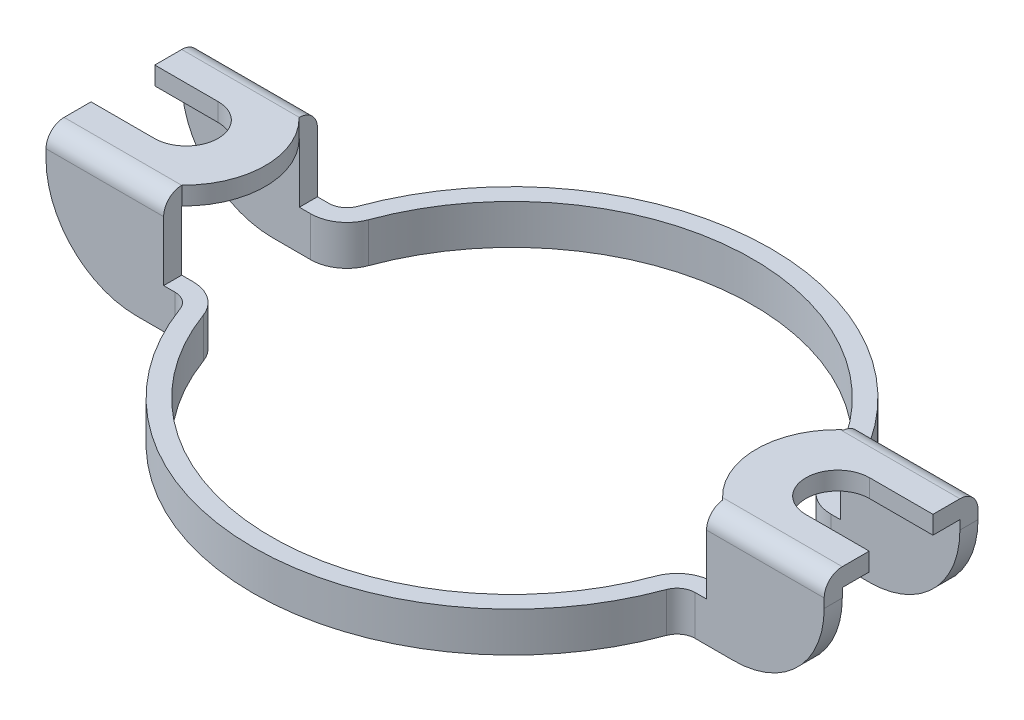
from build123d import *

# Parameters (mm, degrees)
EXTRUDE1_DEPTH = 6.5
FILLET1_R      = 1
SHELL2_START   = -6.5
SHELL2_DEPTH   = 5.5
SKETCH2_R      = 15.25
EXTRUDE2_DEPTH = 3.3
EXTRUDE3_DEPTH = 27.626866185
EXTRUDE4_START = -4.3
EXTRUDE4_DEPTH = 4.3
FILLET2_R      = 5


# Read off the part's stored shape, not the designer's step: Shell2
with BuildPart() as part:
    # Sketch1 → Extrude1 (new body)
    with BuildSketch(Plane(origin=(0, 0, 0), x_dir=(1, 0, 0), z_dir=(0, 1, 0))):
        with BuildLine():
            Line((-21.5, 4.25), (-14.371064679, 4.25))
            ThreePointArc((-14.371064679, 4.25), (-13.797975355, 4.430507091), (-13.431779406, 4.906862745))
            ThreePointArc((-13.431779406, 4.906862745), (0, 14.3), (13.431779406, 4.906862745))
            ThreePointArc((13.431779406, 4.906862745), (13.797975355, 4.430507091), (14.371064679, 4.25))
            Line((14.371064679, 4.25), (21.5, 4.25))
            Line((21.5, 4.25), (21.5, -4.25))
            Line((21.5, -4.25), (14.371064679, -4.25))
            ThreePointArc((14.371064679, -4.25), (13.797975355, -4.430507091), (13.431779406, -4.906862745))
            ThreePointArc((13.431779406, -4.906862745), (0, -14.3), (-13.431779406, -4.906862745))
            ThreePointArc((-13.431779406, -4.906862745), (-13.797975355, -4.430507091), (-14.371064679, -4.25))
            Line((-14.371064679, -4.25), (-21.5, -4.25))
            Line((-21.5, -4.25), (-21.5, 4.25))
        make_face()
    extrude(amount=-EXTRUDE1_DEPTH)

    # Fillet1
    fillet1_edges = [part.edges().sort_by_distance(p)[0] for p in [
        (-17.935532339, 0, -4.25),
        (-13.797975355, 0, -4.430507091),
        (0, 0, -14.3),
        (13.797975355, 0, -4.430507091),
        (17.935532339, 0, -4.25),
        (17.935532339, 0, 4.25),
        (13.797975355, 0, 4.430507091),
        (0, 0, 14.3),
        (-13.797975355, 0, 4.430507091),
        (-17.935532339, 0, 4.25),
    ]]
    fillet(fillet1_edges, radius=FILLET1_R)

    # Shell2 outline → Shell2 (cut)
    with BuildSketch(Plane(origin=(0, 0, 0), x_dir=(1, 0, 0), z_dir=(0, 1, 0)).offset(SHELL2_START)):
        with BuildLine():
            ThreePointArc((-12.492494132, 4.56372549), (-13.224886032, 3.611014183), (-14.371064679, 3.25))
            Line((-14.371064679, 3.25), (-21.5, 3.25))
            Line((-21.5, 3.25), (-21.5, -3.25))
            Line((-21.5, -3.25), (-14.371064679, -3.25))
            ThreePointArc((-14.371064679, -3.25), (-13.224886032, -3.611014183), (-12.492494132, -4.56372549))
            ThreePointArc((-12.492494132, -4.56372549), (0, -13.3), (12.492494132, -4.56372549))
            ThreePointArc((12.492494132, -4.56372549), (13.224886032, -3.611014183), (14.371064679, -3.25))
            Line((14.371064679, -3.25), (21.5, -3.25))
            Line((21.5, -3.25), (21.5, 3.25))
            Line((21.5, 3.25), (14.371064679, 3.25))
            ThreePointArc((14.371064679, 3.25), (13.224886032, 3.611014183), (12.492494132, 4.56372549))
            ThreePointArc((12.492494132, 4.56372549), (0, 13.3), (-12.492494132, 4.56372549))
        make_face()
    extrude(amount=SHELL2_DEPTH, mode=Mode.SUBTRACT)

    # Sketch2 → Extrude2 (cut)
    with BuildSketch(Plane.XZ.offset(1)):
        Circle(SKETCH2_R)
    extrude(amount=EXTRUDE2_DEPTH, mode=Mode.SUBTRACT)

    # Sketch4 → Extrude3 (cut, through all)
    with BuildSketch(Plane(origin=(0, 0, 0), x_dir=(1, 0, 0), z_dir=(0, 1, 0))):
        with BuildLine():
            Line((18, 1.761490195), (22, 1.761490195))
            Line((22, 1.761490195), (22, -1.761490195))
            Line((22, -1.761490195), (18, -1.761490195))
            ThreePointArc((18, -1.761490195), (16.238509805, 0), (18, 1.761490195))
        make_face()
        with BuildLine():
            Line((-18, -1.761490195), (-22, -1.761490195))
            Line((-22, -1.761490195), (-22, 1.761490195))
            Line((-22, 1.761490195), (-18, 1.761490195))
            ThreePointArc((-18, 1.761490195), (-16.238509805, 0), (-18, -1.761490195))
        make_face()
    extrude(amount=-EXTRUDE3_DEPTH, mode=Mode.SUBTRACT)

    # Sketch5 → Extrude4 (cut)
    with BuildSketch(Plane(origin=(0, 0, 0), x_dir=(1, 0, 0), z_dir=(0, 1, 0)).offset(EXTRUDE4_START)):
        with BuildLine():
            Line((15, -15), (-15, -15))
            Line((-15, -15), (-15, -3.233227979))
            ThreePointArc((-15, -3.233227979), (-13.629894061, 0), (-15, 3.233227979))
            Line((-15, 3.233227979), (-15, 15))
            Line((-15, 15), (15, 15))
            Line((15, 15), (15, 3.354101966))
            ThreePointArc((15, 3.354101966), (13.5, 0), (15, -3.354101966))
            Line((15, -3.354101966), (15, -15))
        make_face()
    extrude(amount=EXTRUDE4_DEPTH, mode=Mode.SUBTRACT)

    # Fillet2
    fillet2_edges = [part.edges().sort_by_distance(p)[0] for p in [
        (21.5, -6.5, 3.75),
        (-21.5, -6.5, -3.75),
        (-21.5, -6.5, 3.75),
        (21.5, -6.5, -3.75),
    ]]
    fillet(fillet2_edges, radius=FILLET2_R)


solid = part.part
